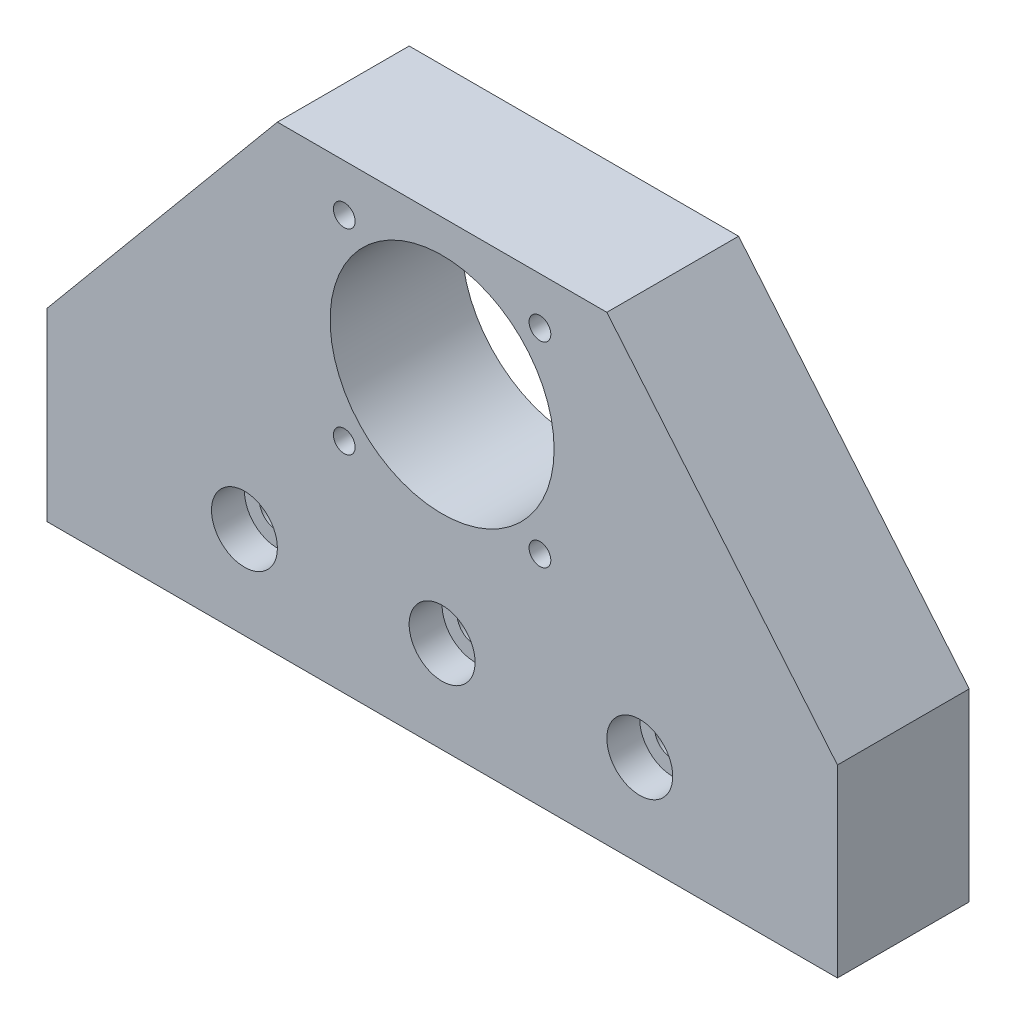
from build123d import *

# Parameters (mm, degrees)
BOSS_EXTRUDE1_DEPTH            = 20
CBORE_FOR_M5_SHCS1_D           = 5.5
CBORE_FOR_M5_SHCS1_CBORE_D     = 10
CBORE_FOR_M5_SHCS1_CBORE_DEPTH = 5
SKETCH4_R                      = 17
CUT_EXTRUDE1_DEPTH             = 95.339811321
M4_TAPPED_HOLE1_D              = 3.3


with BuildPart() as part:
    # Sketch1 → Boss-Extrude1 (new body)
    with BuildSketch(Plane.XY):
        Polygon((60, 0), (-60, 0), (-60, 28), (-25, 70), (25, 70), (60, 28), align=None)
    extrude(amount=BOSS_EXTRUDE1_DEPTH)

    # CBORE for M5 SHCS1 (through all)
    with Locations(Plane(origin=(-30, 14, 20), x_dir=(1, 0, 0), z_dir=(0, 0, 1))):
        with Locations((0, 0), (30, 0), (60, 0)):
            CounterBoreHole(CBORE_FOR_M5_SHCS1_D / 2, CBORE_FOR_M5_SHCS1_CBORE_D / 2, CBORE_FOR_M5_SHCS1_CBORE_DEPTH)

    # Sketch4 → Cut-Extrude1 (cut, through all)
    with BuildSketch(Plane.XY.offset(20)):
        with Locations((0, 48)):
            Circle(SKETCH4_R)
    extrude(amount=-CUT_EXTRUDE1_DEPTH, mode=Mode.SUBTRACT)

    # M4 Tapped Hole1 (through all)
    with Locations(Plane(origin=(-14.849242405, 62.849242405, 20), x_dir=(1, 0, 0), z_dir=(0, 0, 1))):
        with Locations((0, 0), (29.69848481, 0), (29.69848481, -29.69848481), (0, -29.69848481)):
            Hole(M4_TAPPED_HOLE1_D / 2)


solid = part.part
